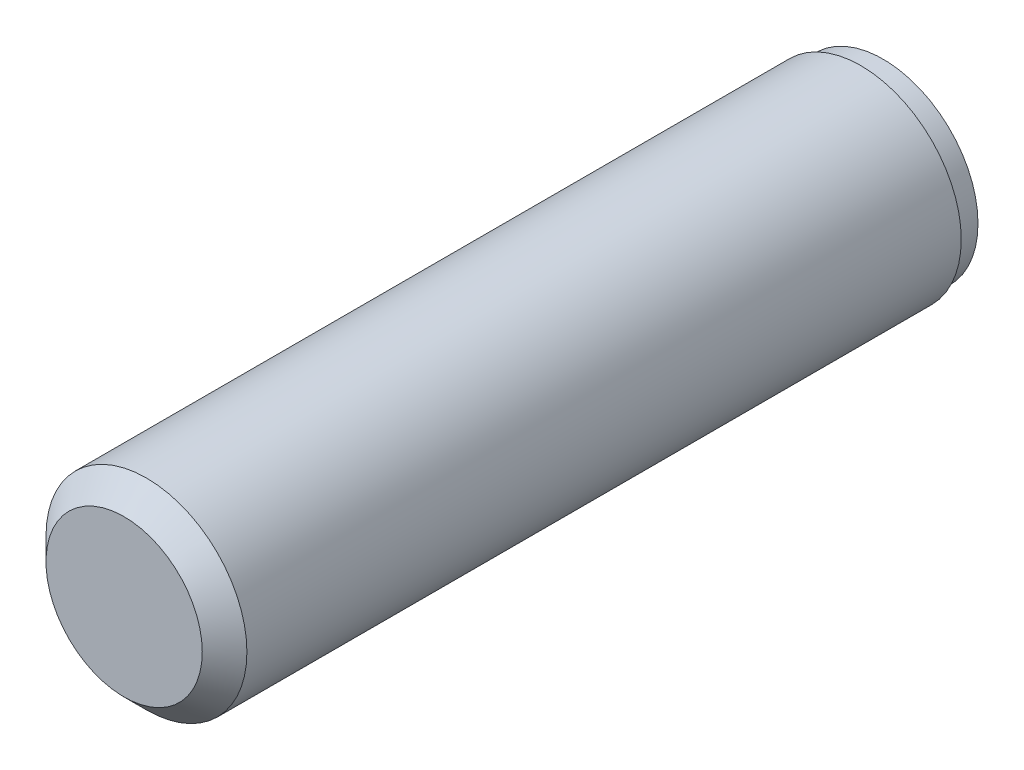
from build123d import *

# Parameters (mm, degrees)
SKETCH1_R           = 9
BOSS_EXTRUDE1_DEPTH = 66
SKETCH2_R           = 8.5
BOSS_EXTRUDE2_DEPTH = 2
SKETCH3_R           = 8
CUT_EXTRUDE1_DEPTH  = 1.5
SKETCH4_R           = 3
BOSS_EXTRUDE3_DEPTH = 1
FILLET1_R           = 1
CHAMFER1_SIZE       = 2


with BuildPart() as part:
    # Sketch1 → Boss-Extrude1 (new body)
    with BuildSketch(Plane.XY):
        Circle(SKETCH1_R)
    extrude(amount=BOSS_EXTRUDE1_DEPTH)

    # Sketch2 → Boss-Extrude2 (add)
    with BuildSketch(Plane(origin=(0, 0, 0), x_dir=(-1, 0, 0), z_dir=(0, 0, -1))):
        Circle(SKETCH2_R)
    extrude(amount=BOSS_EXTRUDE2_DEPTH)

    # Sketch3 → Cut-Extrude1 (cut)
    with BuildSketch(Plane(origin=(0, 0, -2), x_dir=(-1, 0, 0), z_dir=(0, 0, -1))):
        Circle(SKETCH3_R)
    extrude(amount=-CUT_EXTRUDE1_DEPTH, mode=Mode.SUBTRACT)

    # Sketch4 → Boss-Extrude3 (add)
    with BuildSketch(Plane(origin=(0, 0, -0.5), x_dir=(-1, 0, 0), z_dir=(0, 0, -1))):
        with Locations((0, 4)):
            Circle(SKETCH4_R)
        with Locations((0, -4)):
            Circle(SKETCH4_R)
    extrude(amount=BOSS_EXTRUDE3_DEPTH)

    # Fillet1
    fillet1_edges = [part.edges().sort_by_distance(p)[0] for p in [
        (3, 4, -1.5),
        (3, -4, -1.5),
    ]]
    fillet(fillet1_edges, radius=FILLET1_R - 0.0001)  # a hair under: the kernel refuses the full size

    # Chamfer1
    chamfer1_edges = [part.edges().sort_by_distance(p)[0] for p in [
        (-9, 0, 66),
    ]]
    chamfer(chamfer1_edges, length=CHAMFER1_SIZE)


solid = part.part
